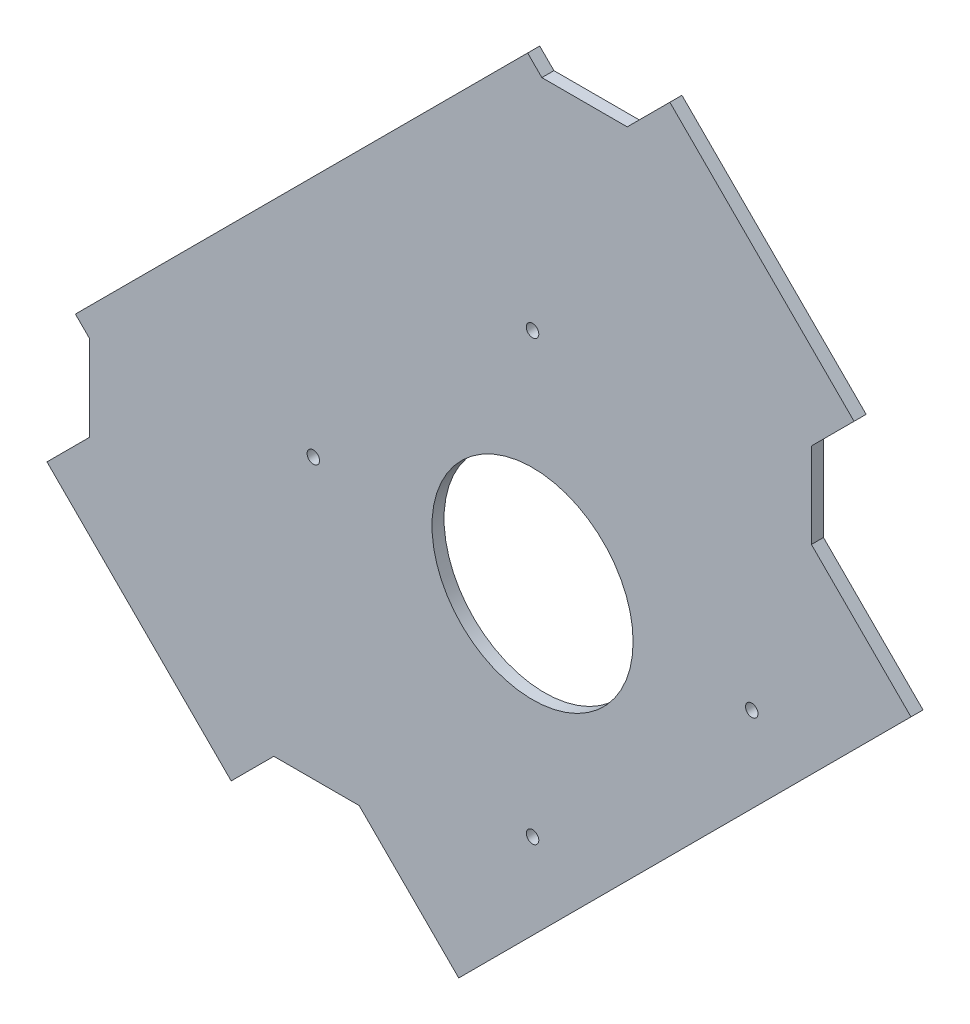
from build123d import *

# Parameters (mm, degrees)
SKETCH1_R      = 1.55
SKETCH1_R_2    = 25
EXTRUDE1_DEPTH = 3
CHAMFER1_SIZE  = 15


with BuildPart() as part:
    # Sketch1 → Extrude1 (new body)
    with BuildSketch(Plane.XY):
        Polygon((34.135880806, 120.720395726), (79.935688912, 74.92058762), (58.722485476, 53.707384184), (94.077824536, 18.352045125), (-18.352045125, -94.077824536), (-53.707384184, -58.722485476), (-74.92058762, -79.935688912), (-120.720395726, -34.135880806), (-99.50719229, -12.922677371), (-113.649327914, 1.219458253), (-1.219458253, 113.649327914), (12.922677371, 99.50719229), align=None)
        with Locations((0, -54.5)):
            Circle(SKETCH1_R, mode=Mode.SUBTRACT)
        with Locations((54.5, 0)):
            Circle(SKETCH1_R, mode=Mode.SUBTRACT)
        with Locations((-54.5, 0)):
            Circle(SKETCH1_R, mode=Mode.SUBTRACT)
        with Locations((0, 54.5)):
            Circle(SKETCH1_R, mode=Mode.SUBTRACT)
        Circle(SKETCH1_R_2, mode=Mode.SUBTRACT)
    extrude(amount=EXTRUDE1_DEPTH)

    # Chamfer1
    chamfer1_edges = [part.edges().sort_by_distance(p)[0] for p in [
        (12.922677371, 99.50719229, 1.5),
        (58.722485476, 53.707384184, 1.5),
        (-53.707384184, -58.722485476, 1.5),
        (-99.50719229, -12.922677371, 1.5),
    ]]
    chamfer(chamfer1_edges, length=CHAMFER1_SIZE)


solid = part.part
